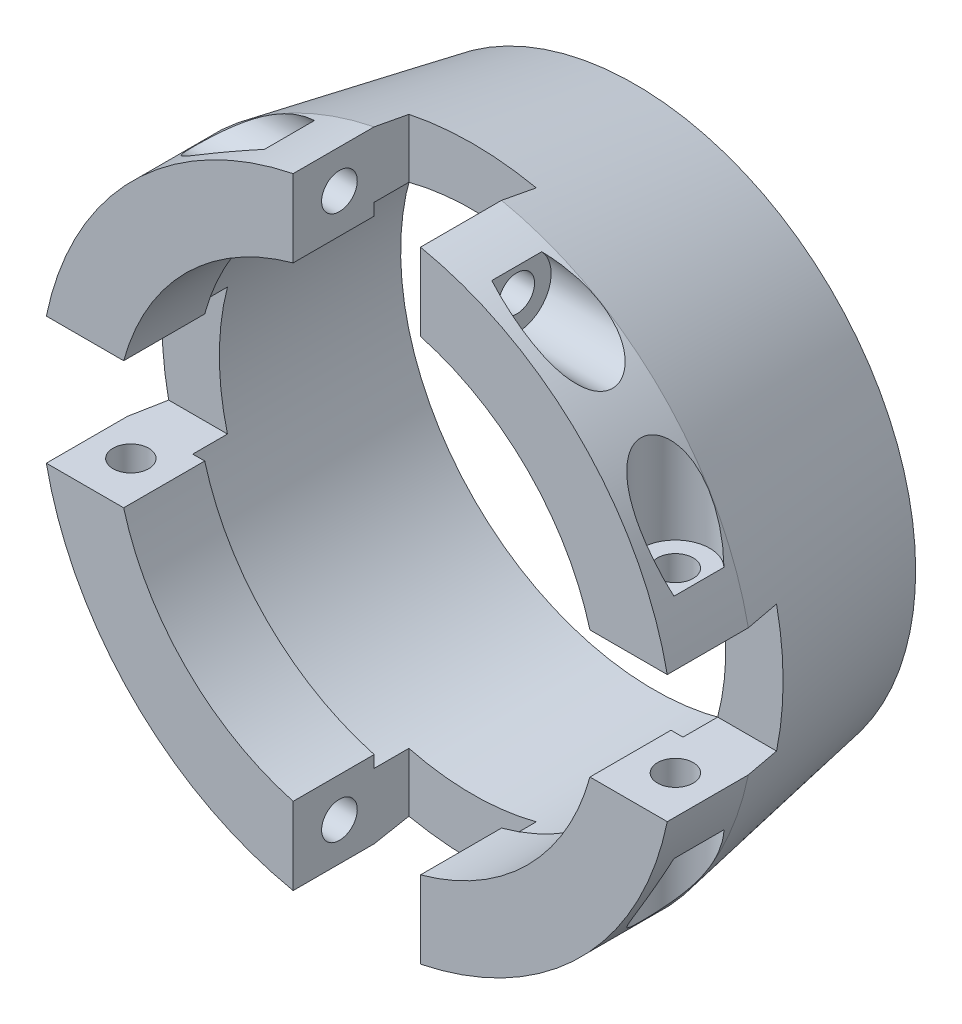
from build123d import *

# Parameters (mm, degrees)
PULLEY_RECESS_START = -12.7
SKETCH5_W           = 13.97
SKETCH5_H           = 12.7
PULLEY_RECESS_DEPTH = 72.92587845
CIRPATTERN1_COUNT   = 4
CHAMFER1_SIZE       = 2.54
CHAMFER1_SIZE_2     = 3.165934508


with BuildPart() as part:
    # Sketch1 → base_ring (revolve)
    with BuildSketch(Plane.YZ, mode=Mode.PRIVATE) as base_ring_sk:
        Polygon((27.78125, 0), (27.78125, 24.13), (26.51125, 24.13), (26.51125, 33.02), (34.76625, 33.02), (34.76625, 24.13), (30.32125, 0), align=None)
    revolve(base_ring_sk.sketch.rotate(Axis((0, 0, 0), (0, 0, 1)), 90), axis=Axis((0, 0, 0), (0, 0, 1)))

    # Sketch5 → pulley_recess (cut)
    with BuildSketch(Plane.XY.offset(33.02).offset(PULLEY_RECESS_START)):
        with Locations((0, 31.924521531)):
            Rectangle(SKETCH5_W, SKETCH5_H)
    pulley_recess = extrude(amount=PULLEY_RECESS_DEPTH, mode=Mode.SUBTRACT)

    # Sketch8 → pulley_bolt_hole (revolve, cut)
    with BuildSketch(Plane(origin=(34.76625, 29.86633275, 27.94), x_dir=(0, 0, -1), z_dir=(0, 1, 0))):
        Polygon((0, 0), (0, 39.275163199), (1.9558, 38.1), (1.9558, 22.3012), (3.77063, 22.3012), (3.77063, 0), align=None)
    pulley_bolt_hole = revolve(axis=Axis((41.11625, 29.86633275, 27.94), (-1, 0, 0)), mode=Mode.SUBTRACT)

    # bolthole_mirror: pulley_bolt_hole across plane
    add(pulley_bolt_hole.mirror(Plane(origin=(0, 0, 0), x_dir=(0, 0, 1), z_dir=(1, 0, 0))), mode=Mode.SUBTRACT)

    # CirPattern1: pulley_recess, pulley_bolt_hole ×4 about axis
    cirpattern1_axis = Axis((0, 0, 0), (0, 0, 1))
    add([pulley_recess.rotate(cirpattern1_axis, i * 360 / CIRPATTERN1_COUNT) for i in range(1, CIRPATTERN1_COUNT)], mode=Mode.SUBTRACT)
    add([pulley_bolt_hole.rotate(cirpattern1_axis, i * 360 / CIRPATTERN1_COUNT) for i in range(1, CIRPATTERN1_COUNT)], mode=Mode.SUBTRACT)

    # CirPattern1 copy 1 sketch → CirPattern1 copy 1 (revolve, cut)
    with BuildSketch(Plane(origin=(-29.86633275, -34.76625, 27.94), x_dir=(0, 0, -1), z_dir=(-1, 0, 0))):
        Polygon((0, 0), (0, -39.275163199), (1.9558, -38.1), (1.9558, -22.3012), (3.77063, -22.3012), (3.77063, 0), align=None)
    revolve(axis=Axis((-29.86633275, -41.11625, 27.94), (0, -1, 0)), mode=Mode.SUBTRACT)

    # CirPattern1 copy 2 sketch → CirPattern1 copy 2 (revolve, cut)
    with BuildSketch(Plane(origin=(34.76625, -29.86633275, 27.94), x_dir=(0, 0, -1), z_dir=(0, -1, 0))):
        Polygon((0, 0), (0, -39.275163199), (1.9558, -38.1), (1.9558, -22.3012), (3.77063, -22.3012), (3.77063, 0), align=None)
    revolve(axis=Axis((41.11625, -29.86633275, 27.94), (1, 0, 0)), mode=Mode.SUBTRACT)

    # CirPattern1 copy 3 sketch → CirPattern1 copy 3 (revolve, cut)
    with BuildSketch(Plane(origin=(29.86633275, 34.76625, 27.94), x_dir=(0, 0, -1), z_dir=(1, 0, 0))):
        Polygon((0, 0), (0, -39.275163199), (1.9558, -38.1), (1.9558, -22.3012), (3.77063, -22.3012), (3.77063, 0), align=None)
    revolve(axis=Axis((29.86633275, 41.11625, 27.94), (0, 1, 0)), mode=Mode.SUBTRACT)

    # Chamfer1
    # the kernel refuses this chamfer: 3.165934508, 2.54 mm, written as the material it takes off along each edge
    with BuildSketch(Plane(origin=(0, 0, 0), x_dir=(-1, 0, 0), z_dir=(0, 1, 0))) as chamfer1_piece_1:
        Polygon((30.32125 + CHAMFER1_SIZE * 0.181162429477, CHAMFER1_SIZE * 0.983453188589), (30.32125 - CHAMFER1_SIZE_2, 0), (30.32125, 0), align=None)
    revolve(axis=Axis((0, 0, 0), (0, 0, 1)), mode=Mode.SUBTRACT)


solid = part.part
